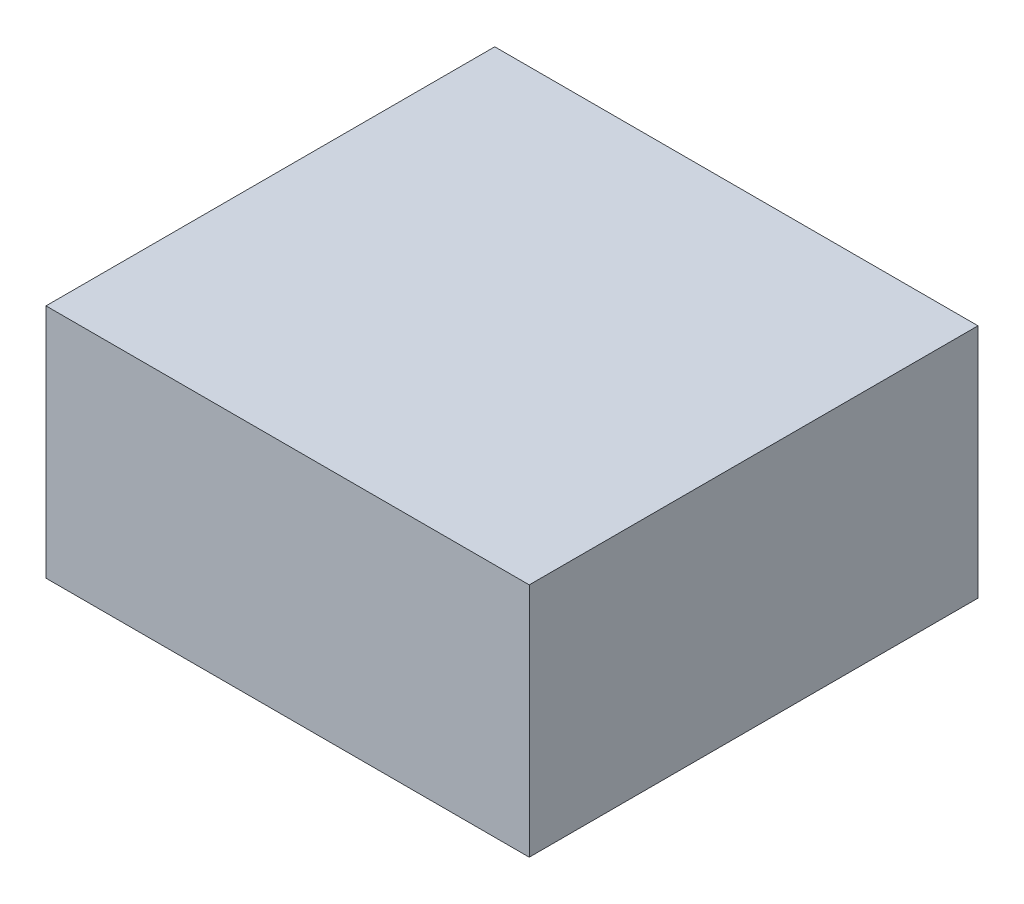
from build123d import *

# Parameters (mm, degrees)
SKETCH1_W           = 153.67
SKETCH1_H           = 142.6972
BOSS_EXTRUDE1_DEPTH = 75.0062


with BuildPart() as part:
    # Sketch1 → Boss-Extrude1 (new body)
    with BuildSketch(Plane(origin=(0, 0, 0), x_dir=(1, 0, 0), z_dir=(0, 1, 0))):
        Rectangle(SKETCH1_W, SKETCH1_H)
    extrude(amount=BOSS_EXTRUDE1_DEPTH)


solid = part.part
